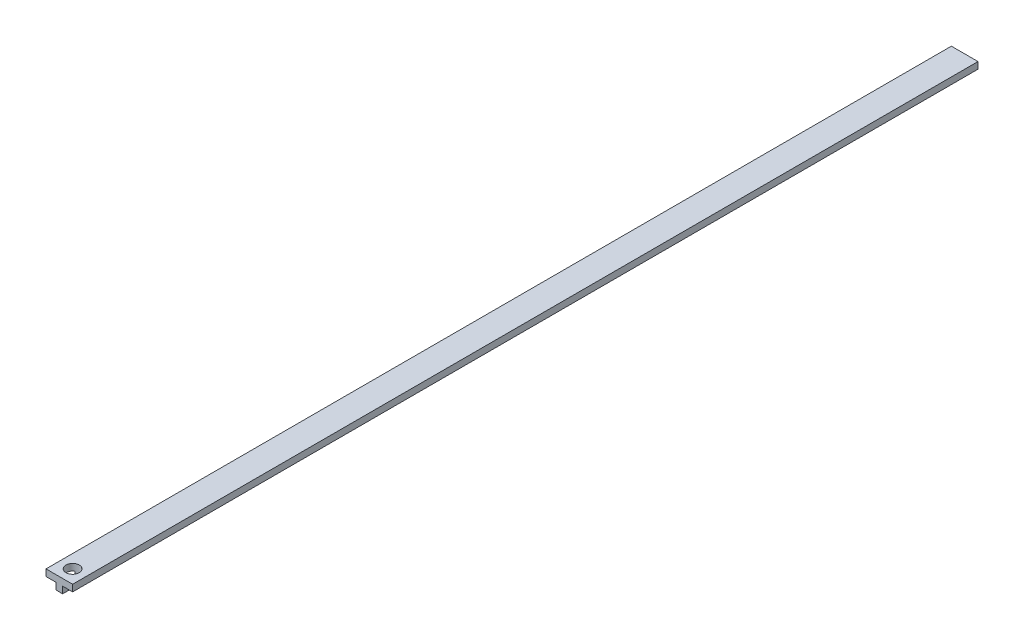
from build123d import *

# Parameters (mm, degrees)
BOSS_EXTRUDE1_DEPTH = 215.9
SKETCH4_R           = 3.175
CUT_EXTRUDE1_DEPTH  = 217.086683995


with BuildPart() as part:
    # Sketch3 → Boss-Extrude1 (new, symmetric)
    with BuildSketch(Plane.XY):
        Polygon((-6.35, 3.175), (6.35, 3.175), (6.35, 0), (1.5875, 0), (1.5875, -3.175), (-1.5875, -3.175), (-1.5875, 0), (-6.35, 0), align=None)
    extrude(amount=BOSS_EXTRUDE1_DEPTH, both=True)

    # Sketch4 → Cut-Extrude1 (cut, through all)
    with BuildSketch(Plane(origin=(0, 3.175, 0), x_dir=(1, 0, 0), z_dir=(0, 1, 0))):
        with Locations((0, -209.55)):
            Circle(SKETCH4_R)
    extrude(amount=-CUT_EXTRUDE1_DEPTH, mode=Mode.SUBTRACT)


solid = part.part
